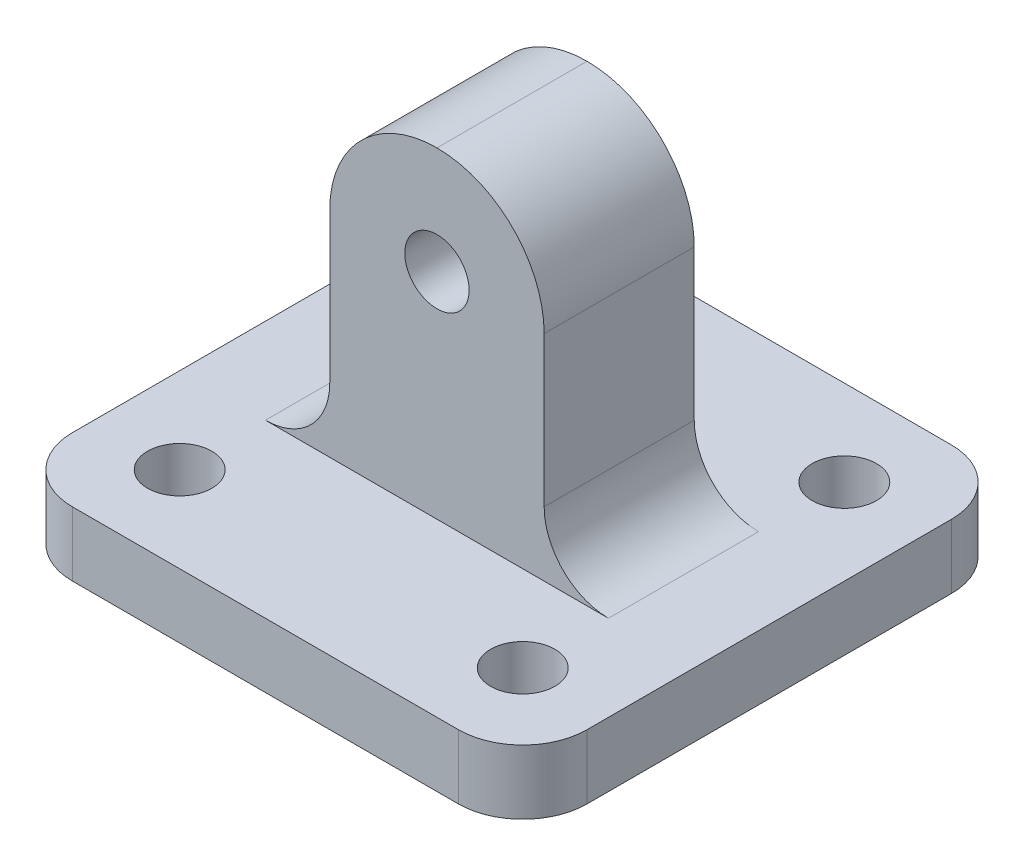
from build123d import *

# Parameters (mm, degrees)
SKETCH_1_W          = 24
SKETCH_1_H          = 23
EXTRUDE_1_DEPTH     = 3
SKETCH_2_W          = 10
SKETCH_2_H          = 7
EXTRUDE_2_DEPTH     = 15
SKETCH_3_R          = 1.5
CUT_EXTRUDE_2_DEPTH = 27.324893162
SKETCH_4_R          = 1.5
CUT_EXTRUDE_3_DEPTH = 23.388613177
FILLET_1_R          = 5
FILLET_2_R          = 3
FILLET_3_R          = 3


with BuildPart() as part:
    # 草图1 → 凸台-拉伸1 (new body)
    with BuildSketch(Plane(origin=(0, 0, 0), x_dir=(1, 0, 0), z_dir=(0, 1, 0))):
        Rectangle(SKETCH_1_W, SKETCH_1_H)
    extrude(amount=EXTRUDE_1_DEPTH)

    # 草图2 → 凸台-拉伸2 (add)
    with BuildSketch(Plane(origin=(0, 3, 0), x_dir=(1, 0, 0), z_dir=(0, 1, 0))):
        Rectangle(SKETCH_2_W, SKETCH_2_H)
    extrude(amount=EXTRUDE_2_DEPTH)

    # 草图3 → 切除-拉伸2 (cut, through all)
    with BuildSketch(Plane.XY.offset(3.5)):
        with Locations((0, 13)):
            Circle(SKETCH_3_R)
    extrude(amount=-CUT_EXTRUDE_2_DEPTH, mode=Mode.SUBTRACT)

    # 草图4 → 切除-拉伸3 (cut, through all)
    with BuildSketch(Plane(origin=(0, 3, 0), x_dir=(1, 0, 0), z_dir=(0, 1, 0))):
        with Locations(Location((-8, 7.5, 0), (0, 0, 270))):
            Circle(SKETCH_4_R)
        with Locations(Location((-8, -7.5, 0), (0, 0, 270))):
            Circle(SKETCH_4_R)
        with Locations(Location((8, -7.5, 0), (0, 0, 270))):
            Circle(SKETCH_4_R)
        with Locations(Location((8, 7.5, 0), (0, 0, 270))):
            Circle(SKETCH_4_R)
    extrude(amount=-CUT_EXTRUDE_3_DEPTH, mode=Mode.SUBTRACT)

    # 圆角1
    fillet_1_edges = [part.edges().sort_by_distance(p)[0] for p in [
        (-5, 18, 0),
        (5, 18, 0),
    ]]
    fillet(fillet_1_edges, radius=FILLET_1_R - 0.0001)  # a hair under: the kernel refuses the full size

    # 圆角2
    fillet_2_edges = [part.edges().sort_by_distance(p)[0] for p in [
        (5, 3, 0),
        (-5, 3, 0),
    ]]
    fillet(fillet_2_edges, radius=FILLET_2_R)

    # 圆角3
    fillet_3_edges = [part.edges().sort_by_distance(p)[0] for p in [
        (12, 1.5, 11.5),
        (-12, 1.5, 11.5),
        (-12, 1.5, -11.5),
        (12, 1.5, -11.5),
    ]]
    fillet(fillet_3_edges, radius=FILLET_3_R)


solid = part.part
